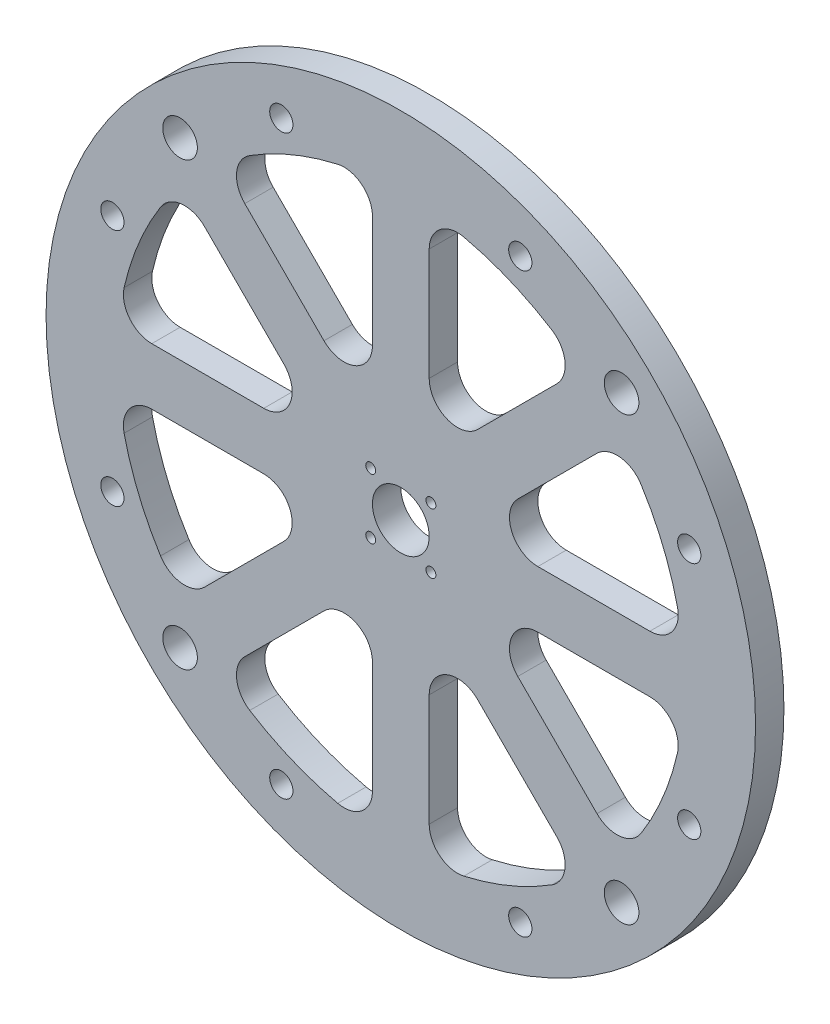
from build123d import *

# Parameters (mm, degrees)
SKETCH1_R               = 125
SKETCH1_R_2             = 6.1
SKETCH1_R_3             = 4.1
BOSS_EXTRUDE1_DEPTH     = 10
CUT_EXTRUDE2_DEPTH      = 178.059312096
CUT_EXTRUDE2_DEPTH_BACK = 178.059312096
FILLET1_R               = 10
CUT_EXTRUDE3_DEPTH      = 178.059312096
CUT_EXTRUDE3_DEPTH_BACK = 178.059312096
SKETCH2_4_R             = 10
SKETCH2_4_R_2           = 1.75


with BuildPart() as part:
    # Sketch1 → Boss-Extrude1 (new body)
    with BuildSketch(Plane.XY):
        Circle(SKETCH1_R)
        with Locations((77.781745931, 77.781745931)):
            Circle(SKETCH1_R_2, mode=Mode.SUBTRACT)
        with Locations((101.626748576, 42.09517756)):
            Circle(SKETCH1_R_3, mode=Mode.SUBTRACT)
        with Locations((42.09517756, 101.626748576)):
            Circle(SKETCH1_R_3, mode=Mode.SUBTRACT)
        with Locations((101.626748576, -42.09517756)):
            Circle(SKETCH1_R_3, mode=Mode.SUBTRACT)
        with Locations((77.781745931, -77.781745931)):
            Circle(SKETCH1_R_2, mode=Mode.SUBTRACT)
        with Locations((42.09517756, -101.626748576)):
            Circle(SKETCH1_R_3, mode=Mode.SUBTRACT)
        with Locations((-42.09517756, -101.626748576)):
            Circle(SKETCH1_R_3, mode=Mode.SUBTRACT)
        with Locations((-77.781745931, -77.781745931)):
            Circle(SKETCH1_R_2, mode=Mode.SUBTRACT)
        with Locations((-101.626748576, -42.09517756)):
            Circle(SKETCH1_R_3, mode=Mode.SUBTRACT)
        with Locations((-101.626748576, 42.09517756)):
            Circle(SKETCH1_R_3, mode=Mode.SUBTRACT)
        with Locations((-77.781745931, 77.781745931)):
            Circle(SKETCH1_R_2, mode=Mode.SUBTRACT)
        with Locations((-42.09517756, 101.626748576)):
            Circle(SKETCH1_R_3, mode=Mode.SUBTRACT)
    extrude(amount=BOSS_EXTRUDE1_DEPTH)

    # Sketch2 → Cut-Extrude2 (cut, two sides: drawn at the far end of the back side and taken through both)
    with BuildSketch(Plane.XY.offset(-CUT_EXTRUDE2_DEPTH_BACK)):
        with BuildLine():
            Line((-63.285168585, 77.427304209), (-10, 24.142135624))
            Line((-10, 24.142135624), (-10, 99.498743711))
            ThreePointArc((-10, 99.498743711), (-38.268343237, 92.387953251), (-63.285168585, 77.427304209))
        make_face()
        with BuildLine():
            ThreePointArc((63.285168585, 77.427304209), (38.268343237, 92.387953251), (10, 99.498743711))
            Line((10, 99.498743711), (10, 24.142135624))
            Line((10, 24.142135624), (63.285168585, 77.427304209))
        make_face()
        with BuildLine():
            Line((-24.142135624, 10), (-77.427304209, 63.285168585))
            ThreePointArc((-77.427304209, 63.285168585), (-92.387953251, 38.268343237), (-99.498743711, 10))
            Line((-99.498743711, 10), (-24.142135624, 10))
        make_face()
        with BuildLine():
            ThreePointArc((99.498743711, 10), (92.387953251, 38.268343237), (77.427304209, 63.285168585))
            Line((77.427304209, 63.285168585), (24.142135624, 10))
            Line((24.142135624, 10), (99.498743711, 10))
        make_face()
        with BuildLine():
            Line((-24.142135624, -10), (-99.498743711, -10))
            ThreePointArc((-99.498743711, -10), (-92.387953251, -38.268343237), (-77.427304209, -63.285168585))
            Line((-77.427304209, -63.285168585), (-24.142135624, -10))
        make_face()
        with BuildLine():
            Line((-10, -24.142135624), (-63.285168585, -77.427304209))
            ThreePointArc((-63.285168585, -77.427304209), (-38.268343237, -92.387953251), (-10, -99.498743711))
            Line((-10, -99.498743711), (-10, -24.142135624))
        make_face()
        with BuildLine():
            ThreePointArc((77.427304209, -63.285168585), (92.387953251, -38.268343237), (99.498743711, -10))
            Line((99.498743711, -10), (24.142135624, -10))
            Line((24.142135624, -10), (77.427304209, -63.285168585))
        make_face()
        with BuildLine():
            Line((10, -24.142135624), (10, -99.498743711))
            ThreePointArc((10, -99.498743711), (38.268343237, -92.387953251), (63.285168585, -77.427304209))
            Line((63.285168585, -77.427304209), (10, -24.142135624))
        make_face()
    extrude(amount=CUT_EXTRUDE2_DEPTH + CUT_EXTRUDE2_DEPTH_BACK, mode=Mode.SUBTRACT)

    # Fillet1
    fillet1_edges = [part.edges().sort_by_distance(p)[0] for p in [
        (-99.498743711, 10, 5),
        (-77.427304209, 63.285168585, 5),
        (-24.142135624, 10, 5),
        (-10, -99.498743711, 5),
        (-63.285168585, -77.427304209, 5),
        (-10, -24.142135624, 5),
        (-77.427304209, -63.285168585, 5),
        (-99.498743711, -10, 5),
        (-24.142135624, -10, 5),
        (99.498743711, -10, 5),
        (77.427304209, -63.285168585, 5),
        (24.142135624, -10, 5),
        (63.285168585, -77.427304209, 5),
        (10, -99.498743711, 5),
        (10, -24.142135624, 5),
        (10, 99.498743711, 5),
        (63.285168585, 77.427304209, 5),
        (10, 24.142135624, 5),
        (77.427304209, 63.285168585, 5),
        (99.498743711, 10, 5),
        (24.142135624, 10, 5),
        (-63.285168585, 77.427304209, 5),
        (-10, 99.498743711, 5),
        (-10, 24.142135624, 5),
    ]]
    fillet(fillet1_edges, radius=FILLET1_R)

    # Sketch2<4> → Cut-Extrude3 (cut, two sides: drawn at the far end of the back side and taken through both)
    with BuildSketch(Plane.XY.offset(-CUT_EXTRUDE3_DEPTH_BACK)):
        Circle(SKETCH2_4_R)
        with Locations((10.606601718, 10.606601718)):
            Circle(SKETCH2_4_R_2)
        with Locations((10.606601718, -10.606601718)):
            Circle(SKETCH2_4_R_2)
        with Locations((-10.606601718, -10.606601718)):
            Circle(SKETCH2_4_R_2)
        with Locations((-10.606601718, 10.606601718)):
            Circle(SKETCH2_4_R_2)
    extrude(amount=CUT_EXTRUDE3_DEPTH + CUT_EXTRUDE3_DEPTH_BACK, mode=Mode.SUBTRACT)


solid = part.part
